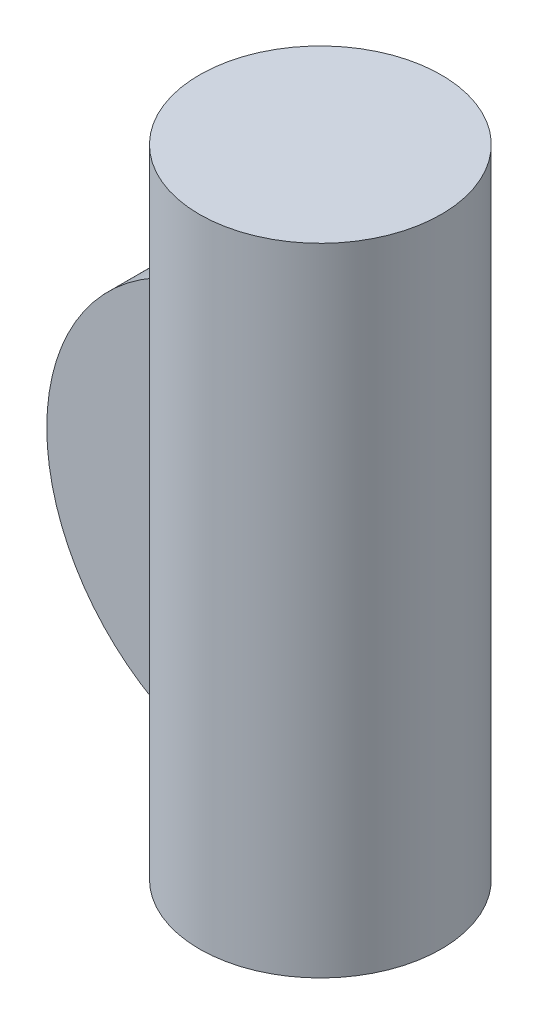
from build123d import *

# Parameters (mm, degrees)
SKETCH1_R                = 2.413
BOSS_EXTRUDE1_DEPTH      = 12.7
BOSS_EXTRUDE2_DEPTH      = 1.27
BOSS_EXTRUDE2_DEPTH_BACK = 1.27


with BuildPart() as part:
    # Sketch1 → Boss-Extrude1 (new body)
    with BuildSketch(Plane(origin=(0, 0, 0), x_dir=(1, 0, 0), z_dir=(0, 1, 0))):
        Circle(SKETCH1_R)
    extrude(amount=BOSS_EXTRUDE1_DEPTH)

    # Sketch2 → Boss-Extrude2 (add, two sides: drawn at the far end of the back side and taken through both)
    with BuildSketch(Plane.XY.offset(-BOSS_EXTRUDE2_DEPTH_BACK)):
        with BuildLine():
            ThreePointArc((0, 10.541), (-4.191, 6.35), (0, 2.159))
            Line((0, 2.159), (0, 10.541))
        make_face()
    extrude(amount=BOSS_EXTRUDE2_DEPTH + BOSS_EXTRUDE2_DEPTH_BACK)


solid = part.part
